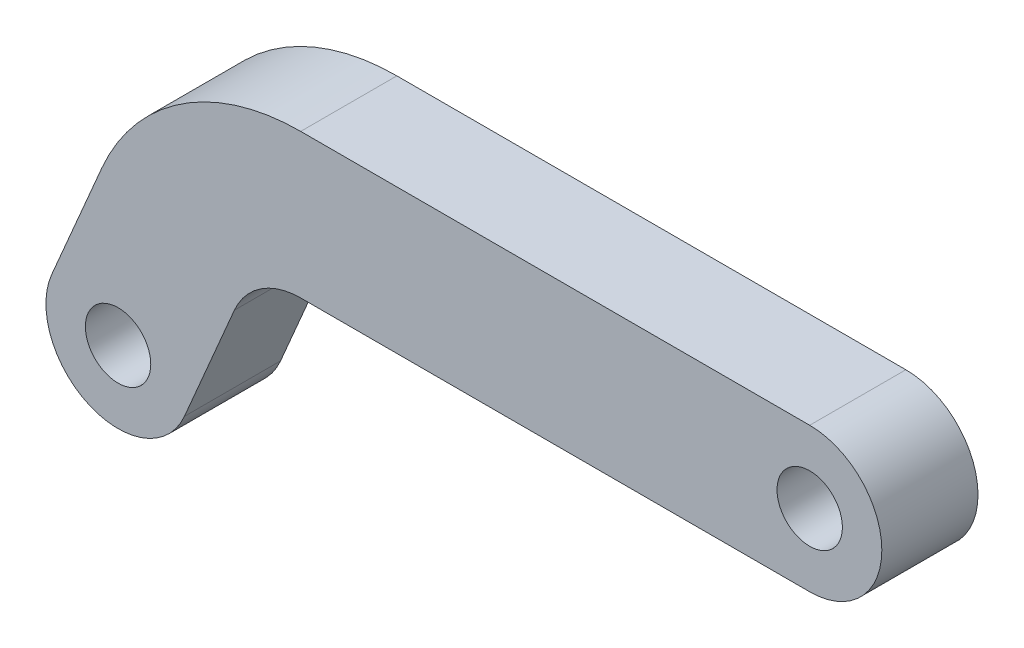
from build123d import *

# Parameters (mm, degrees)
SKETCH1_R           = 2.159
BOSS_EXTRUDE1_DEPTH = 3.175


with BuildPart() as part:
    # Sketch1 → Boss-Extrude1 (new, symmetric)
    with BuildSketch(Plane.XY):
        with BuildLine():
            Line((45.670028206, 18.267652669), (12.06019837, 18.267652669))
            ThreePointArc((12.06019837, 18.267652669), (4.189532933, 15.904299676), (-1.077295482, 9.596104194))
            Line((-1.077295482, 9.596104194), (-4.379164618, 1.871983841))
            ThreePointArc((-4.379164618, 1.871983841), (-1.871983841, -4.379164618), (4.379164618, -1.871983841))
            Line((4.379164618, -1.871983841), (7.681033753, 5.852136511))
            ThreePointArc((7.681033753, 5.852136511), (9.436643224, 7.954868338), (12.06019837, 8.742652669))
            Line((12.06019837, 8.742652669), (45.670028206, 8.742652669))
            ThreePointArc((45.670028206, 8.742652669), (50.432528206, 13.505152669), (45.670028206, 18.267652669))
        make_face()
        Circle(SKETCH1_R, mode=Mode.SUBTRACT)
        with Locations((45.670028206, 13.505152669)):
            Circle(SKETCH1_R, mode=Mode.SUBTRACT)
    extrude(amount=BOSS_EXTRUDE1_DEPTH, both=True)


solid = part.part
